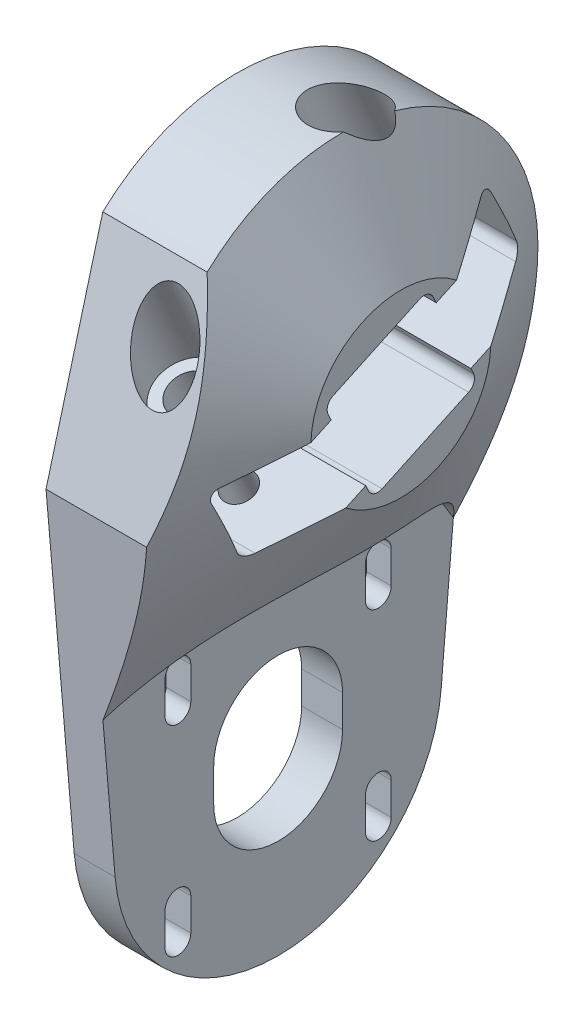
from build123d import *

# Parameters (mm, degrees)
BOSS_EXTRUDE1_DEPTH = 6.35
CUT_EXTRUDE18_DEPTH = 10
SKETCH20_R          = 57.15
BOSS_EXTRUDE5_DEPTH = 19.05
CUT_EXTRUDE14_DEPTH = 106.568863781
SKETCH22_R          = 3.175
CUT_EXTRUDE15_DEPTH = 112.623305623
SKETCH24_R          = 5
CUT_EXTRUDE16_DEPTH = 117.525117228
SKETCH25_R          = 2.38125
CUT_EXTRUDE17_DEPTH = 10
CHAMFER2_SIZE       = 2.5
FILLET1_R           = 1.5875
SKETCH28_R          = 31
CUT_EXTRUDE19_DEPTH = 105.22344993
CUT_EXTRUDE20_DEPTH = 100.584343315
CUT_EXTRUDE21_DEPTH = 94.849309593


with BuildPart() as part:
    # Sketch1 → Boss-Extrude1 (new body)
    with BuildSketch(Plane(origin=(0, 0, 0), x_dir=(0, 0, -1), z_dir=(1, 0, 0))):
        with BuildLine():
            ThreePointArc((30.369265969, -2.595782062), (0, 30.48), (-30.369265969, -2.595782062))
            Line((-30.369265969, -2.595782062), (-25.307721641, -61.813151718))
            ThreePointArc((-25.307721641, -61.813151718), (0, -85.05), (25.307721641, -61.813151718))
            Line((25.307721641, -61.813151718), (30.369265969, -2.595782062))
        make_face()
        Polygon((-11.960334439, 4.353205728), (4.353205728, 11.960334439), (11.960334439, -4.353205728), (-4.353205728, -11.960334439), align=None, mode=Mode.SUBTRACT)
    extrude(amount=BOSS_EXTRUDE1_DEPTH)

    # Sketch19 → Cut-Extrude18 (cut)
    with BuildSketch(Plane(origin=(6.35, 0, 0), x_dir=(0, 0, -1), z_dir=(1, 0, 0))):
        with BuildLine():
            Line((13.556349186, -39.093650814), (13.556349186, -44.093650814))
            ThreePointArc((13.556349186, -44.093650814), (15.556349186, -46.093650814), (17.556349186, -44.093650814))
            Line((17.556349186, -44.093650814), (17.556349186, -39.093650814))
            ThreePointArc((17.556349186, -39.093650814), (15.556349186, -37.093650814), (13.556349186, -39.093650814))
        make_face()
        with BuildLine():
            Line((-10, -54.65), (-10, -59.65))
            ThreePointArc((-10, -59.65), (0, -69.65), (10, -59.65))
            Line((10, -59.65), (10, -54.65))
            ThreePointArc((10, -54.65), (0, -44.65), (-10, -54.65))
        make_face()
        with BuildLine():
            Line((17.556349186, -75.206349186), (17.556349186, -70.206349186))
            ThreePointArc((17.556349186, -70.206349186), (15.556349186, -68.206349186), (13.556349186, -70.206349186))
            Line((13.556349186, -70.206349186), (13.556349186, -75.206349186))
            ThreePointArc((13.556349186, -75.206349186), (15.556349186, -77.206349186), (17.556349186, -75.206349186))
        make_face()
        with BuildLine():
            Line((-17.556349186, -39.093650814), (-17.556349186, -44.093650814))
            ThreePointArc((-17.556349186, -44.093650814), (-15.556349186, -46.093650814), (-13.556349186, -44.093650814))
            Line((-13.556349186, -44.093650814), (-13.556349186, -39.093650814))
            ThreePointArc((-13.556349186, -39.093650814), (-15.556349186, -37.093650814), (-17.556349186, -39.093650814))
        make_face()
        with BuildLine():
            Line((-13.556349186, -75.206349186), (-13.556349186, -70.206349186))
            ThreePointArc((-13.556349186, -70.206349186), (-15.556349186, -68.206349186), (-17.556349186, -70.206349186))
            Line((-17.556349186, -70.206349186), (-17.556349186, -75.206349186))
            ThreePointArc((-17.556349186, -75.206349186), (-15.556349186, -77.206349186), (-13.556349186, -75.206349186))
        make_face()
    extrude(amount=-CUT_EXTRUDE18_DEPTH, mode=Mode.SUBTRACT)

    # Sketch20 → Boss-Extrude5 (add)
    with BuildSketch(Plane(origin=(6.35, 0, 0), x_dir=(0, 0, -1), z_dir=(1, 0, 0))):
        Circle(SKETCH20_R)
    extrude(amount=BOSS_EXTRUDE5_DEPTH)

    # Sketch21 → Cut-Extrude14 (cut, through all)
    with BuildSketch(Plane.ZY):
        Polygon((-19.089407548, 15.8514714), (-24.456659472, 4.341362505), (-10.862042667, -1.997911421), (-11.960334439, -4.353205728), (4.353205728, -11.960334439), (5.4514975, -9.605040132), (18.939030545, -15.894380081), (24.306282469, -4.384271185), (10.818749424, 1.905068763), (11.960334439, 4.353205728), (-4.353205728, 11.960334439), (-5.494790743, 9.512197474), align=None)
    extrude(amount=-CUT_EXTRUDE14_DEPTH, mode=Mode.SUBTRACT)

    # Sketch22 → Cut-Extrude15 (cut, through all)
    with BuildSketch(Plane(origin=(0, 5.708633119, 2.661979341), x_dir=(-1, 0, 0), z_dir=(0, -0.9063077870366494, -0.4226182617407009))):
        with Locations((-12.5, -16.5)):
            Circle(SKETCH22_R)
    cut_extrude15 = extrude(amount=-CUT_EXTRUDE15_DEPTH, mode=Mode.SUBTRACT)

    # Sketch24 → Cut-Extrude16 (cut, through all)
    with BuildSketch(Plane(origin=(0, 10.312676677, 4.80888011), x_dir=(-1, 0, 0), z_dir=(0, -0.9063077870366494, -0.4226182617407009))):
        with Locations((-12.5, -16.5)):
            Circle(SKETCH24_R)
    cut_extrude16 = extrude(amount=-CUT_EXTRUDE16_DEPTH, mode=Mode.SUBTRACT)

    # Sketch25 → Cut-Extrude17 (cut)
    with BuildSketch(Plane(origin=(0, -5.801475777, -2.705272583), x_dir=(1, 0, 0), z_dir=(0, 0.9063077870366495, 0.4226182617407007))):
        with Locations((12.5, -16.5)):
            Circle(SKETCH25_R)
    cut_extrude17 = extrude(amount=-CUT_EXTRUDE17_DEPTH, mode=Mode.SUBTRACT)

    # Mirror1: Cut-Extrude15, Cut-Extrude16, Cut-Extrude17 across plane
    add(cut_extrude15.mirror(Plane(origin=(0, 0, 0), x_dir=(1, 0, 0), z_dir=(0, 0.4226182617407011, -0.9063077870366493))), mode=Mode.SUBTRACT)
    add(cut_extrude16.mirror(Plane(origin=(0, 0, 0), x_dir=(1, 0, 0), z_dir=(0, 0.4226182617407011, -0.9063077870366493))), mode=Mode.SUBTRACT)
    add(cut_extrude17.mirror(Plane(origin=(0, 0, 0), x_dir=(1, 0, 0), z_dir=(0, 0.4226182617407011, -0.9063077870366493))), mode=Mode.SUBTRACT)


with BuildPart() as body_2:
    # Mirror2: mirrored copy
    add(part.part.mirror(Plane(origin=(0, 0, 0), x_dir=(0, 0, 1), z_dir=(1, 0, 0))))


with BuildPart() as part_1:
    add(part.part)

    # Chamfer2
    chamfer2_edges = [part_1.edges().sort_by_distance(p)[0] for p in [
        (0, -46.093650814, 15.556349186),
        (0, -41.593650814, 13.556349186),
        (0, -37.093650814, 15.556349186),
        (0, -41.593650814, 17.556349186),
        (0, -46.093650814, -15.556349186),
        (0, -41.593650814, -17.556349186),
        (0, -41.593650814, -13.556349186),
        (0, -37.093650814, -15.556349186),
    ]]
    chamfer(chamfer2_edges, length=CHAMFER2_SIZE)

    # Fillet1
    fillet1_edges = [part_1.edges().sort_by_distance(p)[0] for p in [
        (12.7, -4.353205728, -11.960334439),
        (12.7, 4.341362505, -24.456659472),
        (12.7, 11.960334439, -4.353205728),
        (12.7, 15.8514714, -19.089407548),
        (12.7, -4.384271185, 24.306282469),
        (12.7, 4.353205728, 11.960334439),
        (12.7, -11.960334439, 4.353205728),
        (12.7, -15.894380081, 18.939030545),
    ]]
    fillet(fillet1_edges, radius=FILLET1_R)

    # Sketch28 → Cut-Extrude19 (cut, through all)
    with BuildSketch(Plane(origin=(6.35, 0, 0), x_dir=(0, 0, -1), z_dir=(1, 0, 0))):
        with Locations((0, -54.65)):
            Circle(SKETCH28_R)
    extrude(amount=CUT_EXTRUDE19_DEPTH, mode=Mode.SUBTRACT)

    # Sketch31 → Cut-Revolve1 (revolve, cut)
    with BuildSketch(Plane(origin=(0, 0, 0), x_dir=(1, 0, 0), z_dir=(0, 1, 0))):
        Polygon((25.4, -59.952108656), (25.4, -13.97), (6.35, -48.172984338), (6.35, -59.952108656), align=None)
    revolve(axis=Axis((25.4, 0, 0), (-1, 0, 0)), mode=Mode.SUBTRACT)

    # Sketch32 → Cut-Extrude20 (cut, through all)
    with BuildSketch(Plane.ZY.offset(-6.35)):
        with BuildLine():
            ThreePointArc((-30.369265969, -2.595782062), (0, 30.48), (30.369265969, -2.595782062))
            Line((30.369265969, -2.595782062), (27.192308406, -39.764491491))
            ThreePointArc((27.192308406, -39.764491491), (42.606167787, -22.480010821), (48.172984338, 0))
            ThreePointArc((48.172984338, 0), (-22.480010821, 42.606167787), (-27.192308406, -39.764491491))
            Line((-27.192308406, -39.764491491), (-30.369265969, -2.595782062))
        make_face()
    extrude(amount=-CUT_EXTRUDE20_DEPTH, mode=Mode.SUBTRACT)

    # Sketch33 → Cut-Extrude21 (cut, through all)
    with BuildSketch(Plane.ZY):
        with BuildLine():
            Line((29.679571242, -10.664842593), (30.369265969, -2.595782062))
            ThreePointArc((30.369265969, -2.595782062), (28.464776298, 10.898940787), (20.869520673, 22.214713747))
            Line((20.869520673, 22.214713747), (29.679571242, -10.664842593))
        make_face()
    extrude(amount=-CUT_EXTRUDE21_DEPTH, mode=Mode.SUBTRACT)


solid = part_1.part
